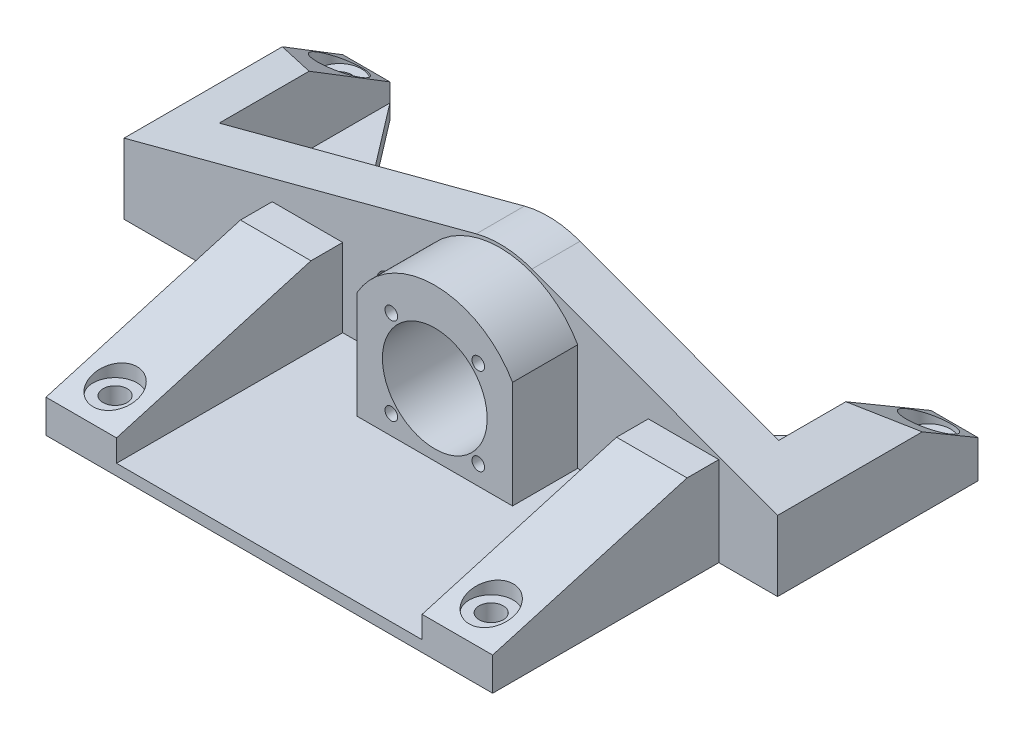
from build123d import *

# Parameters (mm, degrees)
SKETCH2_W                                     = 176.53
SKETCH2_H                                     = 28.1
BOSS_EXTRUDE1_DEPTH                           = 5
SKETCH3_R                                     = 6.635934172
SKETCH3_R_2                                   = 3.325
BOSS_EXTRUDE2_DEPTH                           = 5
SKETCH4_R                                     = 6.635934172
SKETCH4_R_2                                   = 3.325
BOSS_EXTRUDE3_DEPTH                           = 5
SKETCH5_R                                     = 3.175
SKETCH5_R_2                                   = 3.890528803
BOSS_EXTRUDE4_DEPTH                           = 5
SKETCH9_R                                     = 24.15
SKETCH9_R_2                                   = 14.15
SKETCH9_R_3                                   = 1.7
BOSS_EXTRUDE5_DEPTH                           = 20.6
SKETCH7_W                                     = 30.5
SKETCH7_H                                     = 30.5
CUT_EXTRUDE2_DEPTH                            = 26.6
BOSS_EXTRUDE6_DEPTH                           = 12.7
BOSS_EXTRUDE7_DEPTH                           = 9.525
BOSS_EXTRUDE8_DEPTH                           = 9.525
SKETCH16_W                                    = 82.55
SKETCH16_H                                    = 69.099082758
BOSS_EXTRUDE9_DEPTH                           = 3
DELETEFACE1_START                             = 5
DELETEFACE1_DEPTH                             = 20.6
BOSS_EXTRUDE10_DEPTH                          = 6.35
BOSS_EXTRUDE11_DEPTH                          = 6.35
CBORE_FOR_1_4_BUTTON_HEAD_CAP_SCREW1_AT_COUNT = 2
CBORE_FOR_1_4_BUTTON_HEAD_CAP_SCREW1_AT_PITCH = 100.875101487
CBORE_FOR_1_4_BUTTON_HEAD_CAP_SCREW1_2_COUNT  = 2
CBORE_FOR_1_4_BUTTON_HEAD_CAP_SCREW1_2_PITCH  = 156.106713821
CBORE_FOR_1_4_BUTTON_HEAD_CAP_SCREW1_3_COUNT  = 2
CBORE_FOR_1_4_BUTTON_HEAD_CAP_SCREW1_3_PITCH  = 163.897690649
SKETCH21_R                                    = 5.95376
CUT_EXTRUDE3_DEPTH                            = 195.710016667
SKETCH23_W                                    = 8
SKETCH23_H                                    = 28.925707526
CUT_EXTRUDE4_DEPTH                            = 20.6
DELETEFACE5_START                             = 5
DELETEFACE5_DEPTH                             = 20.6
BOSS_EXTRUDE12_DEPTH                          = 4
MOVE_FACE3_BY                                 = 5
MOVE_FACE4_BY                                 = 5
FILLET1_R                                     = 2
MOVE_FACE5_BY                                 = 8


# Read off the part's stored shape, not the designer's step: DeleteFace1, DeleteFace5, Split1, Split2
with BuildPart() as part:
    # Sketch2 → Boss-Extrude1 (new body)
    with BuildSketch(Plane(origin=(0, 0, 0), x_dir=(1, 0, 0), z_dir=(0, 1, 0))):
        with Locations((-88.265, 14.05)):
            Rectangle(SKETCH2_W, SKETCH2_H)
    extrude(amount=BOSS_EXTRUDE1_DEPTH)

    # Sketch5 → Boss-Extrude4 (add)
    # profile 1 of 2: a face of its own
    with BuildSketch(Plane(origin=(0, 5, 0), x_dir=(1, 0, 0), z_dir=(0, 1, 0))):
        with BuildLine():
            Line((0, 28.1), (0, 34.1))
            ThreePointArc((0, 34.1), (-2.58351874, 39.212349648), (-8.231848479, 40.164746186))
            Line((-8.231848479, 40.164746186), (-47.113631063, 28.1))
            Line((-47.113631063, 28.1), (0, 28.1))
        make_face()
        with Locations(Location((-6.35, 34.1, 0), (0, 0, 270))):
            Circle(SKETCH5_R, mode=Mode.SUBTRACT)
    # profile 2 of 2: a face of its own
    with BuildSketch(Plane(origin=(0, 5, 0), x_dir=(1, 0, 0), z_dir=(0, 1, 0))):
        with BuildLine():
            Line((0, 0), (0, -42.25))
            ThreePointArc((0, -42.25), (-4.382179377, -48.287398612), (-11.480372282, -45.991895275))
            Line((-11.480372282, -45.991895275), (-45.025083296, 0))
            Line((-45.025083296, 0), (0, 0))
        make_face()
        with Locations(Location((-6.35, -42.25, 0), (0, 0, 270))):
            Circle(SKETCH5_R_2, mode=Mode.SUBTRACT)
    extrude(amount=-BOSS_EXTRUDE4_DEPTH)


with BuildPart() as body_2:
    # Sketch3 → Boss-Extrude2 (new body)
    with BuildSketch(Plane(origin=(0, 0, 0), x_dir=(-1, 0, 0), z_dir=(0, 0, -1))):
        with BuildLine():
            Line((0, 0), (176.53, 0))
            Line((176.53, 0), (176.53, 19))
            Line((176.53, 19), (81.3938594, 44.168544887))
            ThreePointArc((81.3938594, 44.168544887), (73.819063639, 44.972092209), (66.353902645, 43.457301646))
            Line((66.353902645, 43.457301646), (0, 19))
            Line((0, 19), (0, 0))
        make_face()
        with Locations((75, 20)):
            Circle(SKETCH3_R, mode=Mode.SUBTRACT)
        with Locations((105, 20)):
            Circle(SKETCH3_R_2, mode=Mode.SUBTRACT)
    extrude(amount=-BOSS_EXTRUDE2_DEPTH)

    # Sketch9 → Boss-Extrude5 (add)
    with BuildSketch(Plane.XY.offset(5)):
        with Locations(Location((-75, 20, 0), (0, 0, 235.909915964))):
            Circle(SKETCH9_R)
        with Locations(Location((-75, 20, 0), (0, 0, 180))):
            Circle(SKETCH9_R_2, mode=Mode.SUBTRACT)
        with Locations(Location((-86.75, 31.75, 0), (0, 0, 180))):
            Circle(SKETCH9_R_3, mode=Mode.SUBTRACT)
        with Locations(Location((-63.25, 31.75, 0), (0, 0, 180))):
            Circle(SKETCH9_R_3, mode=Mode.SUBTRACT)
        with Locations(Location((-63.25, 8.25, 0), (0, 0, 180))):
            Circle(SKETCH9_R_3, mode=Mode.SUBTRACT)
        with Locations(Location((-86.75, 8.25, 0), (0, 0, 180))):
            Circle(SKETCH9_R_3, mode=Mode.SUBTRACT)
    extrude(amount=BOSS_EXTRUDE5_DEPTH)

    # Sketch7 → Cut-Extrude2 (cut)
    with BuildSketch(Plane.XY.offset(5)):
        with Locations((-75, 20)):
            Rectangle(SKETCH7_W, SKETCH7_H)
    extrude(amount=-CUT_EXTRUDE2_DEPTH, mode=Mode.SUBTRACT)

    # Sketch14 → Boss-Extrude7 (add, symmetric)
    with BuildSketch(Plane(origin=(-25.4, 0, 0), x_dir=(0, 0, -1), z_dir=(1, 0, 0))):
        Polygon((-74.099082758, 0), (-5, 0), (-5, 24.117845296), (-21.574974436, 24.117845296), (-74.099082758, 8.944214003), align=None)
    extrude(amount=BOSS_EXTRUDE7_DEPTH, both=True)

    # Sketch15 → Boss-Extrude8 (add, symmetric)
    with BuildSketch(Plane(origin=(-127, 0, 0), x_dir=(0, 0, -1), z_dir=(1, 0, 0))):
        Polygon((-74.099082758, 8.944214003), (-74.099082758, 0), (-5, 0), (-5, 24.117845296), (-21.574974436, 24.117845296), align=None)
    extrude(amount=BOSS_EXTRUDE8_DEPTH, both=True)

    # Sketch16 → Boss-Extrude9 (add)
    with BuildSketch(Plane.XZ):
        with Locations((-76.2, 39.549541379)):
            Rectangle(SKETCH16_W, SKETCH16_H)
    extrude(amount=-BOSS_EXTRUDE9_DEPTH)

    # DeleteFace1 outline → DeleteFace1 (cut)
    with BuildSketch(Plane.XY.offset(DELETEFACE1_START)):
        with BuildLine():
            ThreePointArc((-88.535970597, 0), (-75, -4.15), (-61.464029403, 0))
            Line((-61.464029403, 0), (-88.535970597, 0))
        make_face()
    extrude(amount=DELETEFACE1_DEPTH, mode=Mode.SUBTRACT)


with BuildPart() as body_3:
    # Sketch4 → Boss-Extrude3 (new body)
    with BuildSketch(Plane.XY.offset(-33.1)):
        with BuildLine():
            Line((-176.53, 19), (-176.53, 0))
            Line((-176.53, 0), (0, 0))
            Line((0, 0), (0, 19))
            Line((0, 19), (-66.353902645, 43.457301646))
            ThreePointArc((-66.353902645, 43.457301646), (-73.819063639, 44.972092209), (-81.3938594, 44.168544887))
            Line((-81.3938594, 44.168544887), (-176.53, 19))
        make_face()
        with Locations(Location((-75, 20, 0), (0, 0, 180))):
            Circle(SKETCH4_R, mode=Mode.SUBTRACT)
        with Locations(Location((-105, 20, 0), (0, 0, 180))):
            Circle(SKETCH4_R_2, mode=Mode.SUBTRACT)
    extrude(amount=BOSS_EXTRUDE3_DEPTH)


with BuildPart() as body_4:
    # Sketch11 → Boss-Extrude6 (new body)
    with BuildSketch(Plane(origin=(0, 0, 0), x_dir=(0, 0, -1), z_dir=(1, 0, 0))):
        Polygon((28.1, 0), (42.275, 0), (42.275, 8), (37.1, 18), (28.1, 18), align=None)
    extrude(amount=-BOSS_EXTRUDE6_DEPTH)


with BuildPart() as body_2_2:
    # Sketch17 → Boss-Extrude10 (new, symmetric)
    with BuildSketch(Plane(origin=(-6.35, 0, 0), x_dir=(0, 0, -1), z_dir=(1, 0, 0))):
        Polygon((0, 0), (41.135367826, 0), (41.135367826, 10.134139823), (10.348575529, 28.265491808), (0, 28.265491808), align=None)
    extrude(amount=BOSS_EXTRUDE10_DEPTH, both=True)

    # Sketch20 → CBORE for 1/4 Button Head Cap Screw1 (revolve, cut)
    with BuildSketch(Plane(origin=(-6.35, 9.525, -34.1), x_dir=(0, 0, 1), z_dir=(1, 0, 0))):
        Polygon((0, 0), (0, 9.525), (3.2639, 9.525), (3.2639, 0.0254), (5.95376, 0.0254), (5.95376, 0), align=None)
    cbore_for_1_4_button_head_cap_screw1 = revolve(axis=Axis((-6.35, 15.875, -34.1), (0, -1, 0)), mode=Mode.SUBTRACT)


with BuildPart() as body_3_2:
    # Sketch18 → Boss-Extrude11 (new, symmetric)
    with BuildSketch(Plane.ZY.offset(170.18)):
        Polygon((-46.106347996, 0), (0, 0), (0, 27.650979473), (-15.662393155, 27.650979473), (-46.106347996, 8.949692928), align=None)
    extrude(amount=BOSS_EXTRUDE11_DEPTH, both=True)

    # CBORE for 1_4 Button Head Cap Screw1 3: CBORE for 1/4 Button Head Cap Screw1 ×2
    with Locations(*[Vector(-0.9995869944933188, 0, -0.028737439687868672) * (i * CBORE_FOR_1_4_BUTTON_HEAD_CAP_SCREW1_3_PITCH) for i in range(1, CBORE_FOR_1_4_BUTTON_HEAD_CAP_SCREW1_3_COUNT)]):
        add(cbore_for_1_4_button_head_cap_screw1, mode=Mode.SUBTRACT)


with BuildPart() as body_2_1:
    add(body_2.part)

    # CBORE for 1/4 Button Head Cap Screw1 at: CBORE for 1/4 Button Head Cap Screw1 ×2
    with Locations(*[Vector(-0.1888473936501245, 0, 0.9820064469806473) * (i * CBORE_FOR_1_4_BUTTON_HEAD_CAP_SCREW1_AT_PITCH) for i in range(1, CBORE_FOR_1_4_BUTTON_HEAD_CAP_SCREW1_AT_COUNT)]):
        add(cbore_for_1_4_button_head_cap_screw1, mode=Mode.SUBTRACT)

    # CBORE for 1_4 Button Head Cap Screw1 2: CBORE for 1/4 Button Head Cap Screw1 ×2
    with Locations(*[Vector(-0.7728687450196582, 0, 0.6345659169635088) * (i * CBORE_FOR_1_4_BUTTON_HEAD_CAP_SCREW1_2_PITCH) for i in range(1, CBORE_FOR_1_4_BUTTON_HEAD_CAP_SCREW1_2_COUNT)]):
        add(cbore_for_1_4_button_head_cap_screw1, mode=Mode.SUBTRACT)


with BuildPart() as cut_extrude3_tool:
    # Sketch21 → Cut-Extrude3 (new, through all)
    with BuildSketch(Plane.XZ.offset(-9.525)):
        with Locations(Location((-6.35, -34.1, 0), (0, 0, 90))):
            Circle(SKETCH21_R)
        with Locations(Location((-25.4, 64.96, 0), (0, 0, 90))):
            Circle(SKETCH21_R)
        with Locations(Location((-127, 64.96, 0), (0, 0, 90))):
            Circle(SKETCH21_R)
        with Locations(Location((-170.18, -38.81, 0), (0, 0, 90))):
            Circle(SKETCH21_R)
    extrude(amount=-CUT_EXTRUDE3_DEPTH)


with BuildPart() as body_2_3:
    add(body_2_1.part)

    # Cut-Extrude3: cut by cut_extrude3_tool
    add(cut_extrude3_tool.part, mode=Mode.SUBTRACT)

    # Sketch23 → Cut-Extrude4 (cut)
    with BuildSketch(Plane.XY.offset(25.6)):
        with Locations((-100, 17.462853763)):
            Rectangle(SKETCH23_W, SKETCH23_H)
        with Locations((-50, 17.462853763)):
            Rectangle(SKETCH23_W, SKETCH23_H)
    extrude(amount=-CUT_EXTRUDE4_DEPTH, mode=Mode.SUBTRACT)

    # DeleteFace5 outline → DeleteFace5 (add)
    with BuildSketch(Plane.XY.offset(DELETEFACE5_START)):
        with BuildLine():
            Line((-96, 3), (-92.152915204, 3))
            ThreePointArc((-92.152915204, 3), (-94.244436746, 5.409792519), (-96, 8.074292474))
            Line((-96, 8.074292474), (-96, 3))
        make_face()
        with BuildLine():
            ThreePointArc((-54, 8.074292474), (-55.755563254, 5.409792519), (-57.847084796, 3))
            Line((-57.847084796, 3), (-54, 3))
            Line((-54, 3), (-54, 8.074292474))
        make_face()
    extrude(amount=DELETEFACE5_DEPTH)



with BuildPart() as body_2_2_1:
    add(body_2_2.part)

    # Cut-Extrude3: cut by cut_extrude3_tool
    add(cut_extrude3_tool.part, mode=Mode.SUBTRACT)


with BuildPart() as body_3_2_1:
    add(body_3_2.part)

    # Cut-Extrude3: cut by cut_extrude3_tool
    add(cut_extrude3_tool.part, mode=Mode.SUBTRACT)


with BuildPart() as body_4_2:
    # Split1: the piece on the far side of the plane
    add(body_2_2_1.part)
    split(bisect_by=Plane(origin=(6.165549057, 16.727448016, 0), x_dir=(0.9382920658498299, -0.345843894211331, 0), z_dir=(0.345843894211331, 0.93829206584983, 0)), keep=Keep.BOTTOM)


with BuildPart() as body_2_2_2:
    add(body_2_2_1.part)

    # Split1
    split(bisect_by=Plane(origin=(6.165549057, 16.727448016, 0), x_dir=(0.9382920658498299, -0.345843894211331, 0), z_dir=(0.345843894211331, 0.93829206584983, 0)), keep=Keep.TOP)


with BuildPart() as body_4_3:
    # Split2: the piece on the far side of the plane
    add(body_3_2_1.part)
    split(bisect_by=Plane(origin=(-16.244600857, 61.40397222, 0), x_dir=(0.9667417954944176, 0.2557543760021119, 0), z_dir=(0.2557543760021119, -0.9667417954944177, 0)), keep=Keep.BOTTOM)


with BuildPart() as body_3_2_2:
    add(body_3_2_1.part)

    # Split2
    split(bisect_by=Plane(origin=(-16.244600857, 61.40397222, 0), x_dir=(0.9667417954944176, 0.2557543760021119, 0), z_dir=(0.2557543760021119, -0.9667417954944177, 0)), keep=Keep.TOP)


with BuildPart() as body_2_4:
    add(body_2_3.part)

    add(body_3_2_2.part)  # Boss-Extrude12 merges body 3 2

    add(body_4_2.part)  # Boss-Extrude12 merges body 4 2
    # Sketch24 → Boss-Extrude12 (add)
    with BuildSketch(Plane.XZ):
        Polygon((-163.83, -46.106347996), (-139.083749424, -13.738059948), (-40.800135607, -13.738059948), (-12.7, -41.135367826), (-12.7, 0), (-163.83, 0), align=None)
    extrude(amount=-BOSS_EXTRUDE12_DEPTH)

    # Move Face3: a face moved outward by 5.0
    extrude(body_2_4.faces().sort_by_distance((-75, 40.035, 25.6))[0], amount=MOVE_FACE3_BY, dir=(0, 0, 1))

    # Move Face4: a face moved inward by 5.0
    extrude(body_2_4.faces().sort_by_distance((-82.625, 7.8, 5))[0], amount=MOVE_FACE4_BY, dir=(0, 0, 1), mode=Mode.SUBTRACT)

    # Fillet1
    fillet1_edges = [body_2_4.edges().sort_by_distance(p)[0] for p in [
        (-59.75, 35.25, 2.5),
        (-59.75, 4.75, 2.5),
        (-90.25, 4.75, 2.5),
        (-90.25, 35.25, 2.5),
    ]]
    fillet(fillet1_edges, radius=FILLET1_R)

    # Move Face5: a face moved outward by 8.0
    extrude(body_2_4.faces().sort_by_distance((-88.265, 40.5, 5))[0], amount=MOVE_FACE5_BY, dir=(0, 0, 1))


solid = body_2_4.part
